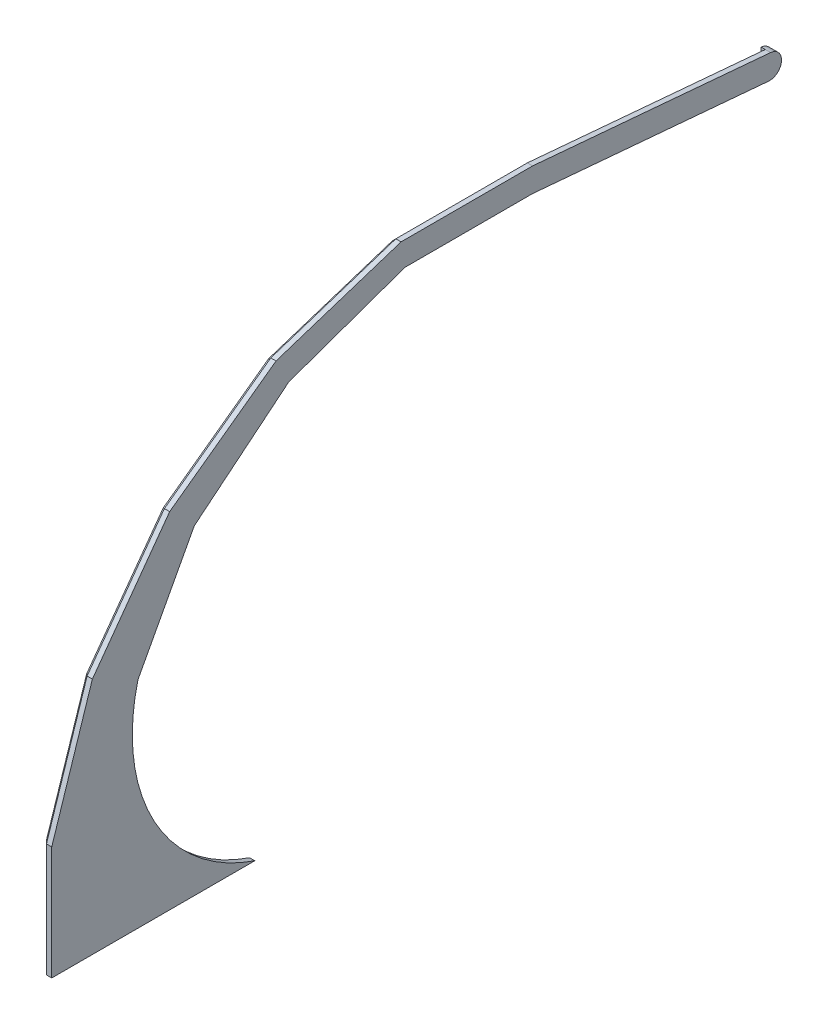
from build123d import *

# Parameters (mm, degrees)
BOSS_EXTRUDE1_DEPTH = 4.4
BOSS_EXTRUDE2_DEPTH = 3.5


with BuildPart() as part:
    # Sketch1 → Boss-Extrude1 (new body)
    with BuildSketch(Plane(origin=(0, 0, 0), x_dir=(0, 0, -1), z_dir=(1, 0, 0))):
        with BuildLine():
            Line((12.615293263, -92.633282396), (182.615293263, -92.633282396))
            ThreePointArc((182.615293263, -92.633282396), (98.271459614, -21.762843967), (84.825943994, 87.579368501))
            Line((84.825943994, 87.579368501), (131.929787104, 175.483372313))
            Line((131.929787104, 175.483372313), (210.884858569, 240.150484061))
            Line((210.884858569, 240.150484061), (308.236471933, 274.689971372))
            Line((308.236471933, 274.689971372), (415.1194685, 274.721469403))
            Line((415.1194685, 274.721469403), (612.615293263, 257.442823643))
            ThreePointArc((612.615293263, 257.442823643), (623.448797672, 266.533213196), (614.358408118, 277.366717604))
            Line((614.358408118, 277.366717604), (415.1194685, 294.797866154))
            Line((415.1194685, 294.797866154), (305.051694272, 294.797866154))
            Line((305.051694272, 294.797866154), (200.371020359, 260.785053385))
            Line((200.371020359, 260.785053385), (111.324320476, 196.088838941))
            Line((111.324320476, 196.088838941), (46.628106033, 107.042139058))
            Line((46.628106033, 107.042139058), (12.615293263, 2.361465145))
            Line((12.615293263, 2.361465145), (12.615293263, -92.633282396))
        make_face()
    extrude(amount=-BOSS_EXTRUDE1_DEPTH)

    # Sketch2 → Boss-Extrude2 (add)
    with BuildSketch(Plane.ZY.offset(4.4)):
        with BuildLine():
            Line((-614.358408118, 277.366717604), (-614.053363019, 273.880036161))
            Line((-614.053363019, 273.880036161), (-415.1194685, 291.284496723))
            Line((-415.1194685, 291.284496723), (-305.608157323, 291.284496723))
            Line((-305.608157323, 291.284496723), (-201.985939032, 257.615597032))
            Line((-201.985939032, 257.615597032), (-113.839615279, 193.573544138))
            Line((-113.839615279, 193.573544138), (-49.797562385, 105.427220385))
            Line((-49.797562385, 105.427220385), (-16.264557774, 2.223244142))
            Line((-16.264557774, 2.223244142), (-16.264557774, -92.633282396))
            Line((-16.264557774, -92.633282396), (-101.905821199, -92.633282396))
            Line((-101.905821199, -92.633282396), (-66.585886121, 0.317253373))
            Line((-66.585886121, 0.317253373), (-81.70742116, 89.16833525))
            Line((-81.70742116, 89.16833525), (-129.49056971, 177.922589707))
            Line((-129.49056971, 177.922589707), (-209.289751158, 243.281058623))
            Line((-209.289751158, 243.281058623), (-307.682152241, 278.189808168))
            Line((-307.682152241, 278.189808168), (-415.271767061, 278.221514437))
            Line((-415.271767061, 278.221514437), (-612.920338363, 260.929505086))
            Line((-612.920338363, 260.929505086), (-612.615293263, 257.442823643))
            ThreePointArc((-612.615293263, 257.442823643), (-623.448797672, 266.533213196), (-614.358408118, 277.366717604))
        make_face()
        Polygon((-573.682640638, 271.389097682), (-563.122976839, 272.312948556), (-562.765638293, 268.228550293), (-573.325302093, 267.30469942), align=None, mode=Mode.SUBTRACT)
        Polygon((-523.275188915, 275.799178265), (-512.715525115, 276.723029139), (-512.35818657, 272.638630876), (-522.91785037, 271.714780003), align=None, mode=Mode.SUBTRACT)
        Polygon((-618.945351863, 268.985044318), (-608.385688063, 269.908895191), (-608.028349518, 265.824496929), (-618.588013318, 264.900646056), align=None, mode=Mode.SUBTRACT)
    extrude(amount=BOSS_EXTRUDE2_DEPTH)


solid = part.part
